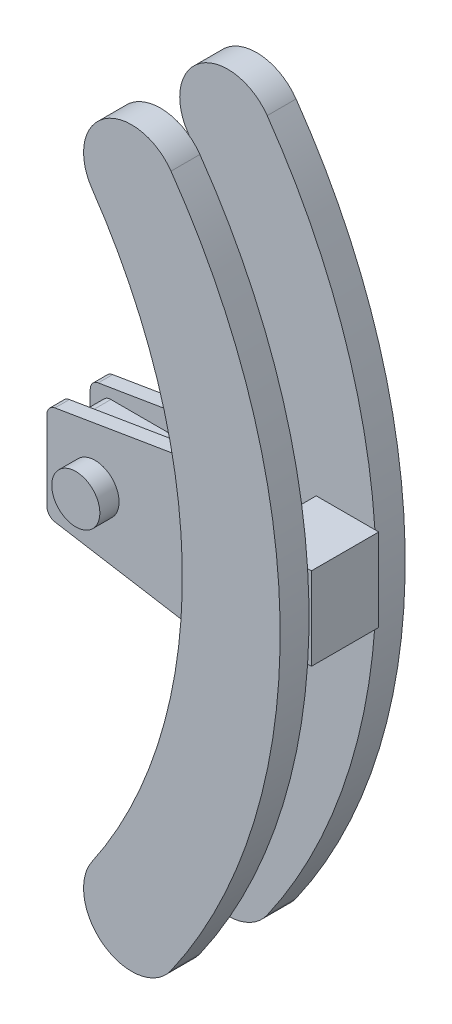
from build123d import *

# Parameters (mm, degrees)
BOSS_EXTRUDE2_DEPTH = 1.5
BOSS_EXTRUDE4_DEPTH = 1.5
FILLET2_START       = -1.5
FILLET2_DEPTH       = 3
SKETCH4_R           = 2.5
BOSS_EXTRUDE5_DEPTH = 2
SKETCH7_W           = 3
SKETCH7_H           = 8.6
BOSS_EXTRUDE6_DEPTH = 10
SKETCH9_W           = 6.5
SKETCH9_H           = 8.6
BOSS_EXTRUDE7_DEPTH = 2
BOSS_EXTRUDE8_DEPTH = 3


with BuildPart() as part:
    # Sketch1 → Boss-Extrude2 (new body)
    with BuildSketch(Plane.XY):
        with BuildLine():
            Line((-10, 4.3), (10, 4.3))
            Line((10, 4.3), (10, -4.3))
            Line((10, -4.3), (-10, -4.3))
            ThreePointArc((-10, -4.3), (-5.7, 0), (-10, 4.3))
        make_face()
    boss_extrude2 = extrude(amount=BOSS_EXTRUDE2_DEPTH)

    # Sketch3 → Boss-Extrude4 (add)
    with BuildSketch(Plane.XY.offset(1.5)):
        with BuildLine():
            Line((7, 6.319539578), (7, -6.319539578))
            ThreePointArc((7, -6.319539578), (6.646374896, -7.082559561), (5.835601013, -7.305933502))
            Line((5.835601013, -7.305933502), (-7.164398987, -5.139266835))
            ThreePointArc((-7.164398987, -5.139266835), (-7.763019982, -4.799247808), (-8, -4.152872912))
            Line((-8, -4.152872912), (-8, 4.152872912))
            ThreePointArc((-8, 4.152872912), (-7.763019982, 4.799247808), (-7.164398987, 5.139266835))
            Line((-7.164398987, 5.139266835), (5.835601013, 7.305933502))
            ThreePointArc((5.835601013, 7.305933502), (6.646374896, 7.082559561), (7, 6.319539578))
        make_face()
    boss_extrude4 = extrude(amount=BOSS_EXTRUDE4_DEPTH)

    # Mirror1: Boss-Extrude2, Boss-Extrude4 across plane
    add(boss_extrude2.mirror(Plane(origin=(-10, 0, 0), x_dir=(1, 0, 0), z_dir=(0, 0, -1))))
    add(boss_extrude4.mirror(Plane(origin=(-10, 0, 0), x_dir=(1, 0, 0), z_dir=(0, 0, -1))))

    # Fillet2: read off the stored shape, not the designer's step
    # Fillet2 outline → Fillet2 (cut)
    with BuildSketch(Plane.XY.offset(FILLET2_START)):
        with BuildLine():
            Line((-10, -4.3), (-5.852711729, -4.3))
            ThreePointArc((-5.852711729, -4.3), (-6.753445183, -3.734372243), (-6.63521895, -2.677358491))
            ThreePointArc((-6.63521895, -2.677358491), (-8.132199356, -3.873153851), (-10, -4.3))
        make_face()
        with BuildLine():
            ThreePointArc((-10, 4.3), (-8.132199356, 3.873153851), (-6.63521895, 2.677358491))
            ThreePointArc((-6.63521895, 2.677358491), (-6.753445183, 3.734372243), (-5.852711729, 4.3))
            Line((-5.852711729, 4.3), (-10, 4.3))
        make_face()
    extrude(amount=FILLET2_DEPTH, mode=Mode.SUBTRACT)

    # Sketch4 → Boss-Extrude5 (add)
    with BuildSketch(Plane.XY.offset(3)):
        with Locations((-3, 0)):
            Circle(SKETCH4_R)
    extrude(amount=BOSS_EXTRUDE5_DEPTH)

    # Sketch7 → Boss-Extrude6 (add)
    with BuildSketch(Plane(origin=(10, 0, 0), x_dir=(0, 0, -1), z_dir=(1, 0, 0))):
        Rectangle(SKETCH7_W, SKETCH7_H)
    extrude(amount=BOSS_EXTRUDE6_DEPTH)

    # Sketch9 → Boss-Extrude7 (add)
    with BuildSketch(Plane.XY.offset(1.5)):
        with Locations((16.75, 0)):
            Rectangle(SKETCH9_W, SKETCH9_H)
    boss_extrude7 = extrude(amount=BOSS_EXTRUDE7_DEPTH)

    # Sketch10 → Boss-Extrude8 (add)
    with BuildSketch(Plane.XY.offset(3.5)):
        with BuildLine():
            ThreePointArc((8.401790779, 35.991921381), (1.457653493, 37.233388065), (0.183185936, 30.295231636))
            ThreePointArc((0.183185936, 30.295231636), (9.577117756, 0), (0.183185936, -30.295231636))
            ThreePointArc((0.183185936, -30.295231636), (1.457653493, -37.233388065), (8.401790779, -35.991921381))
            ThreePointArc((8.401790779, -35.991921381), (19.75, 0), (8.401790779, 35.991921381))
        make_face()
    boss_extrude8 = extrude(amount=BOSS_EXTRUDE8_DEPTH)

    # Mirror2: Boss-Extrude7, Boss-Extrude8 across plane
    add(boss_extrude7.mirror(Plane.XY))
    add(boss_extrude8.mirror(Plane.XY))


solid = part.part
